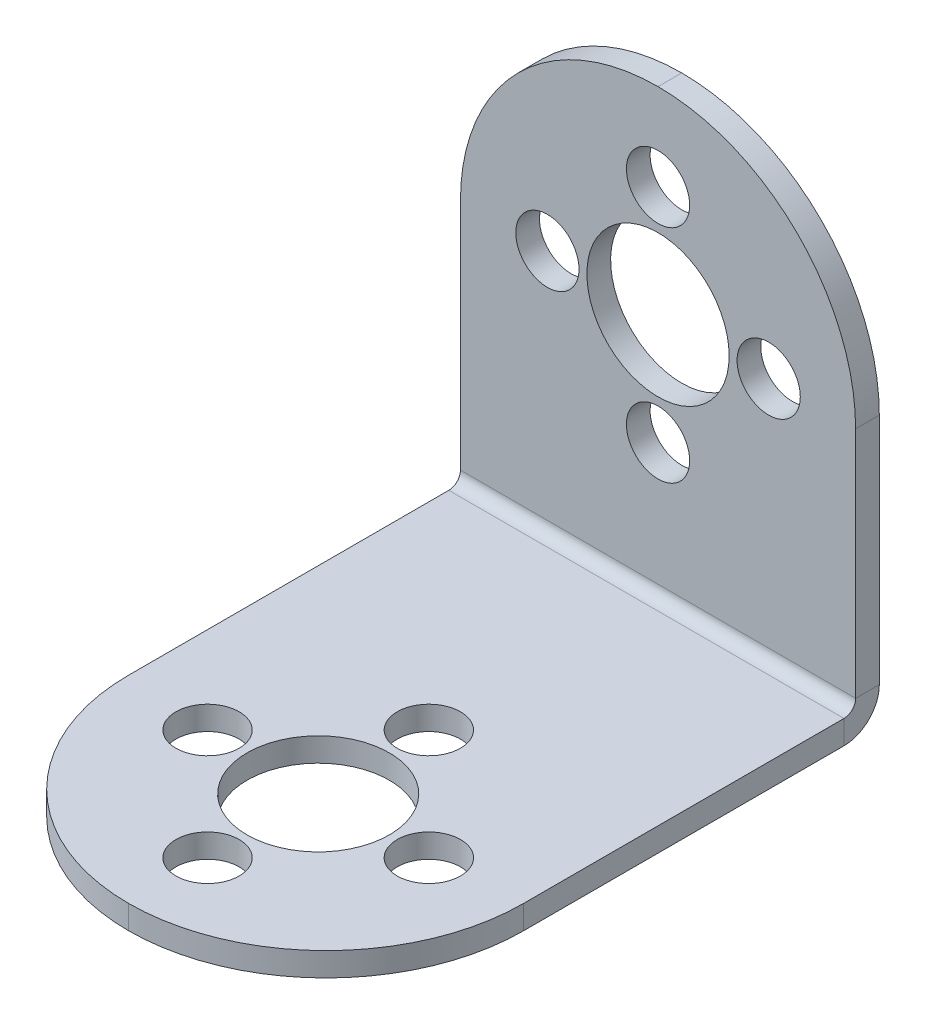
from build123d import *

# Parameters (mm, degrees)
SKETCH1_W                    = 25
SKETCH1_H                    = 35
SKETCH1_R                    = 4.5
SKETCH1_R_2                  = 2
BASE_FLANGE1_DEPTH           = 1.5
EDGE_FLANGE1_STRIP_W         = 7.4732
EDGE_FLANGE1_STRIP_H         = 1.5
EDGE_FLANGE1_STRIP_CUT_DEPTH = 25
EDGE_FLANGE1_DEPTH           = 25
SKETCH9_R                    = 4.5
SKETCH9_R_2                  = 2
CUT_EXTRUDE1_DEPTH           = 10
FILLET1_R                    = 12.5


# Sheet-metal steps are written as plain solids
with BuildPart() as part:
    # Sketch1 → Base-Flange1 (new body)
    with BuildSketch(Plane(origin=(0, 0, 0), x_dir=(1, 0, 0), z_dir=(0, 1, 0))):
        Rectangle(SKETCH1_W, SKETCH1_H)
        with Locations(Location((0, -5.5, 0), (0, 0, 270))):
            Circle(SKETCH1_R, mode=Mode.SUBTRACT)
        with Locations(Location((-7, -5.5, 0), (0, 0, 270))):
            Circle(SKETCH1_R_2, mode=Mode.SUBTRACT)
        with Locations(Location((0, -12.5, 0), (0, 0, 270))):
            Circle(SKETCH1_R_2, mode=Mode.SUBTRACT)
        with Locations(Location((7, -5.5, 0), (0, 0, 270))):
            Circle(SKETCH1_R_2, mode=Mode.SUBTRACT)
        with Locations(Location((0, 1.5, 0), (0, 0, 270))):
            Circle(SKETCH1_R_2, mode=Mode.SUBTRACT)
    extrude(amount=BASE_FLANGE1_DEPTH)

    # Edge-Flange1 strip (across the edge) → Edge-Flange1 strip cut (cut)
    with BuildSketch(Plane(origin=(12.5, 1.5, -17.5), x_dir=(0, 0, 1), z_dir=(-1, 0, 0))):
        with Locations((-1.5, -0.75)):
            Rectangle(EDGE_FLANGE1_STRIP_W, EDGE_FLANGE1_STRIP_H)
    extrude(amount=EDGE_FLANGE1_STRIP_CUT_DEPTH, mode=Mode.SUBTRACT)

    # Edge-Flange1 section (across the edge) → Edge-Flange1 (add)
    with BuildSketch(Plane(origin=(12.5, 1.5, -17.5), x_dir=(0, 0, 1), z_dir=(-1, 0, 0))):
        with BuildLine():
            Line((0, 0.7366), (0, 28))
            Line((0, 28), (1.5, 28))
            Line((1.5, 28), (1.5, 0.7366))
            ThreePointArc((1.5, 0.7366), (1.715745145, 0.215745145), (2.2366, 0))
            Line((2.2366, 0), (2.2366, -1.5))
            ThreePointArc((2.2366, -1.5), (0.655084973, -0.844915027), (0, 0.7366))
        make_face()
    extrude(amount=EDGE_FLANGE1_DEPTH)

    # Sketch9 → Cut-Extrude1 (cut)
    with BuildSketch(Plane.XY.offset(-16)):
        with Locations((0, 17)):
            Circle(SKETCH9_R)
        with Locations((-7, 17)):
            Circle(SKETCH9_R_2)
        with Locations((7, 17)):
            Circle(SKETCH9_R_2)
        with Locations((0, 24)):
            Circle(SKETCH9_R_2)
        with Locations((0, 10)):
            Circle(SKETCH9_R_2)
    extrude(amount=-CUT_EXTRUDE1_DEPTH, mode=Mode.SUBTRACT)

    # Fillet1
    fillet1_edges = [part.edges().sort_by_distance(p)[0] for p in [
        (12.5, 0.75, 17.5),
        (-12.5, 0.75, 17.5),
        (12.5, 29.5, -16.75),
        (-12.5, 29.5, -16.75),
    ]]
    fillet(fillet1_edges, radius=FILLET1_R - 0.0001)  # a hair under: the kernel refuses the full size


solid = part.part
